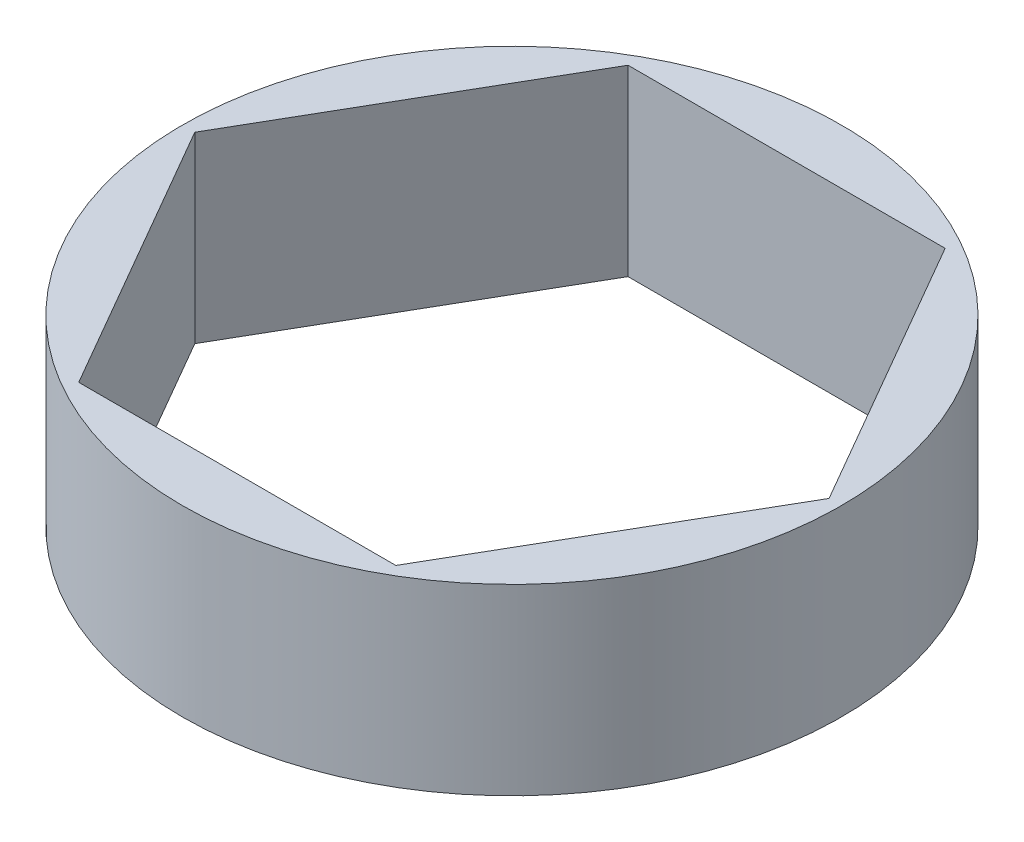
from build123d import *

# Parameters (mm, degrees)
SKETCH1_R           = 9
BOSS_EXTRUDE1_DEPTH = 5


with BuildPart() as part:
    # Sketch1 → Boss-Extrude1 (new body)
    with BuildSketch(Plane(origin=(0, 0, 0), x_dir=(1, 0, 0), z_dir=(0, 1, 0))):
        Circle(SKETCH1_R)
        Polygon((8.660254038, 0), (4.330127019, 7.5), (-4.330127019, 7.5), (-8.660254038, 0), (-4.330127019, -7.5), (4.330127019, -7.5), align=None, mode=Mode.SUBTRACT)
    extrude(amount=BOSS_EXTRUDE1_DEPTH)


solid = part.part
